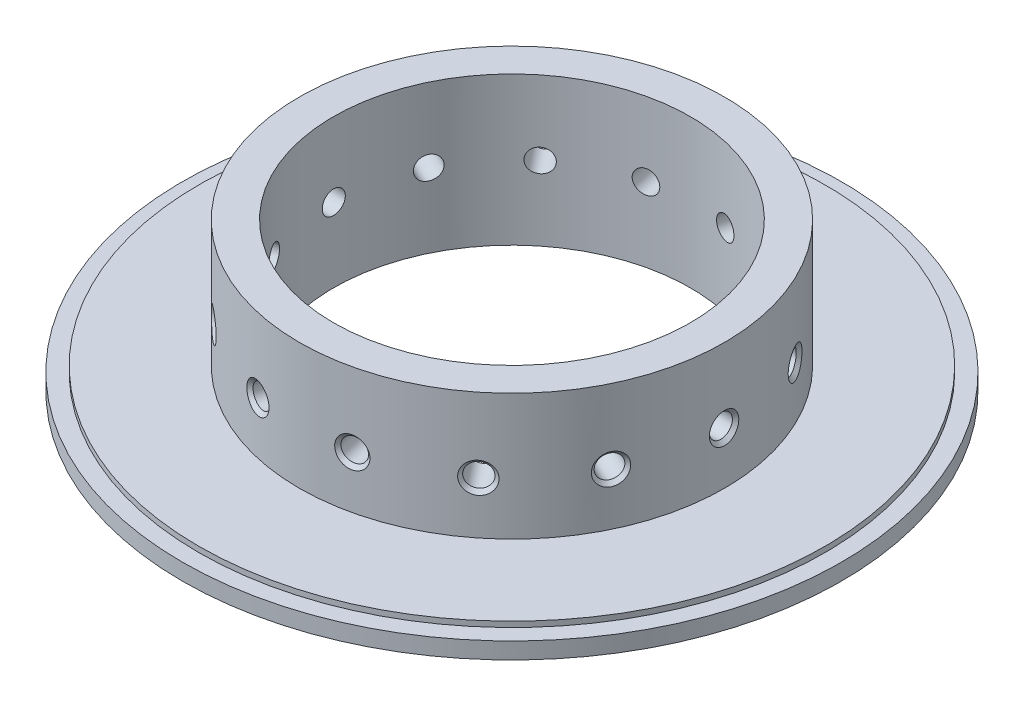
from build123d import *

# Parameters (mm, degrees)
CIRPATTERN1_COUNT = 14


# Read off the part's stored shape, not the designer's step: M5 Tapped Hole1
with BuildPart() as part:
    # Sketch1 → Revolve1 (revolve)
    with BuildSketch(Plane.XY, mode=Mode.PRIVATE) as revolve1_sk:
        Polygon((32.5, 0), (60, 0), (60, 3), (57, 3), (57, 4), (38.71, 4), (38.71, 27), (32.5, 27), align=None)
    revolve(revolve1_sk.sketch.rotate(Axis((0, 0, 0), (0, -1, 0)), 90), axis=Axis((0, 0, 0), (0, -1, 0)))

    # M5 Tapped Hole1 outline → M5 Tapped Hole1 (revolve, cut)
    with BuildSketch(Plane(origin=(0, 13.5, 0), x_dir=(0, 1, 0), z_dir=(0, 0, -1))):
        Polygon((2.775016183, 38.710016183), (0, 38.710016183), (0, 32.432046302), (2.1, 32.432046302), (2.1, 38.035), align=None)
    m5_tapped_hole1 = revolve(axis=Axis((0, 13.5, 0), (1, 0, 0)), mode=Mode.SUBTRACT)

    # CirPattern1: M5 Tapped Hole1 ×14 about axis
    cirpattern1_axis = Axis((0, 0, 0), (0, 1, 0))
    for i in range(1, CIRPATTERN1_COUNT):
        add(m5_tapped_hole1.rotate(cirpattern1_axis, i * 360 / CIRPATTERN1_COUNT), mode=Mode.SUBTRACT)


solid = part.part
